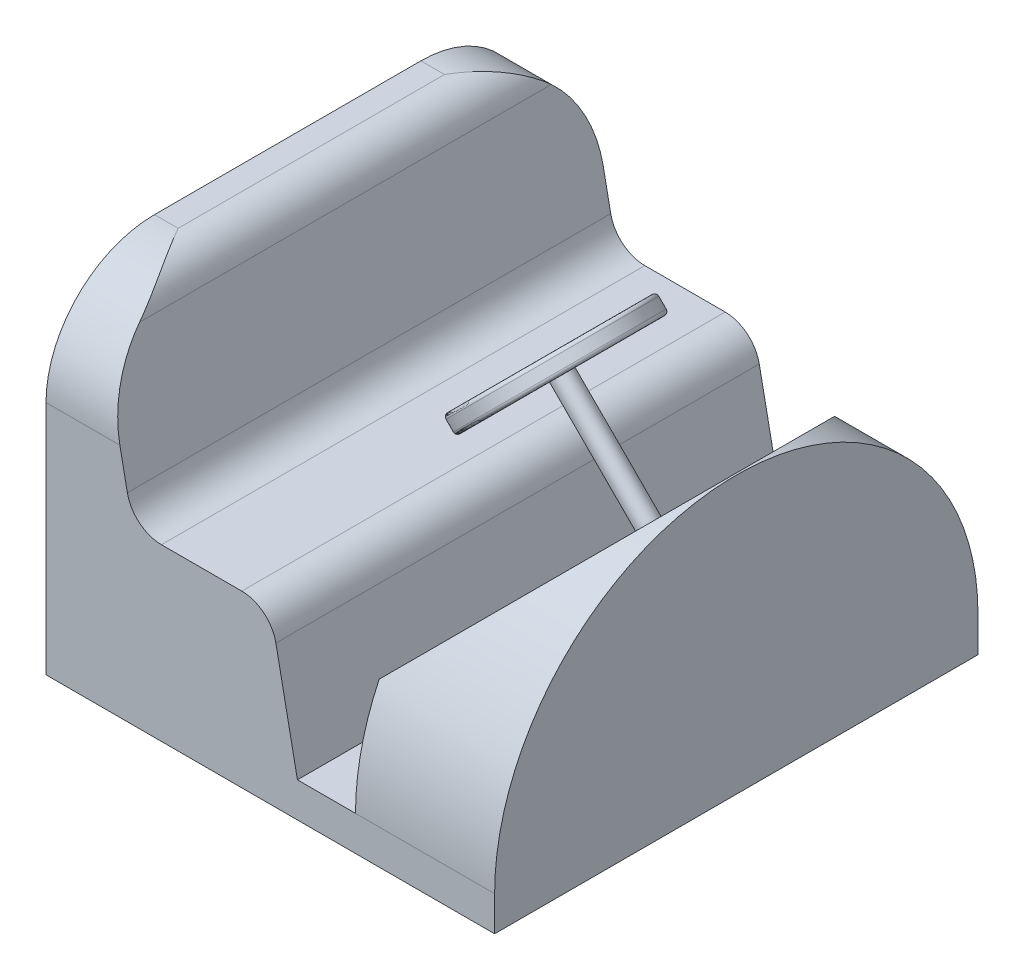
from build123d import *

# Parameters (mm, degrees)
BOSS_EXTRUDE1_DEPTH = 2.5399999999999996
BOSS_EXTRUDE2_DEPTH = 17.653
FILLET1_R           = 2.5399999999999996
FILLET2_R           = 7.9248
FILLET3_R           = 7.9248
BOSS_EXTRUDE3_DEPTH = 17.653
CUT_EXTRUDE2_REACH  = 46.917
SKETCH12_R          = 0.762
BOSS_EXTRUDE4_DEPTH = 10.16
SKETCH13_R          = 6.3500000000000005
BOSS_EXTRUDE5_DEPTH = 1.27
FILLET4_R           = 0.254


# Some blends are built 0.0001 mm under size
with BuildPart() as part:
    # Sketch2 → Boss-Extrude1 (new body)
    with BuildSketch(Plane(origin=(0, 0, 0), x_dir=(1, 0, 0), z_dir=(0, 1, 0))):
        Polygon((0, -17.653), (-32.766, -17.653000000000002), (-32.766000000000005, 17.652999999999988), (-6.49e-15, 17.653), align=None)
    extrude(amount=BOSS_EXTRUDE1_DEPTH)

    # Sketch3 → Boss-Extrude2 (add, symmetric)
    with BuildSketch(Plane.XY):
        Polygon((-32.766, 2.5399999999999996), (-32.766, 25.145999999999997), (-28.955999999999996, 25.145999999999997), (-26.415999999999997, 12.445999999999998), (-16.383, 12.446), (-14.401799999999998, 2.5399999999999996), align=None)
    extrude(amount=BOSS_EXTRUDE2_DEPTH, both=True)

    # Fillet1
    fillet1_edges = [part.edges().sort_by_distance(p)[0] for p in [
        (-16.383, 12.446, 0),
        (-26.415999999999997, 12.445999999999998, 0),
        (-28.955999999999996, 25.145999999999997, 0),
    ]]
    fillet(fillet1_edges, radius=FILLET1_R)

    # Fillet2
    # the kernel refuses this fillet: 7.9248 mm, written as the material it takes off along each edge
    with BuildSketch(Plane(origin=(-52.57799999999999, 25.145999999999997, 17.653000000000006), x_dir=(0, -1, 0), z_dir=(1, 0, 0))) as fillet2_piece_1:
        with BuildLine():
            CenterArc((FILLET2_R, FILLET2_R), FILLET2_R, 180, 90)
            Line((-3.55e-15, FILLET2_R), (0, 0))
            Line((0, 0), (FILLET2_R, 0))
        make_face()
    extrude(amount=41.35169808709485, mode=Mode.SUBTRACT)

    # Fillet3
    # the kernel refuses this fillet: 7.9248 mm, written as the material it takes off along each edge
    with BuildSketch(Plane(origin=(-52.57799999999999, 25.145999999999997, -17.65299999999998), x_dir=(0, -1, 0), z_dir=(1, 0, 0))) as fillet3_piece_1:
        with BuildLine():
            CenterArc((FILLET3_R, -FILLET3_R), FILLET3_R, 90, 90)
            Line((-3.55e-15, -FILLET3_R), (0, 0))
            Line((0, 0), (FILLET3_R, 0))
        make_face()
    extrude(amount=41.35169808709485, mode=Mode.SUBTRACT)

    # Sketch10 → Boss-Extrude3 (add, symmetric)
    with BuildSketch(Plane.XY):
        Polygon((0, 2.5399999999999996), (0, 20.32), (-10.160000000000004, 10.159999999999998), (-10.16, 2.539999999999999), align=None)
    extrude(amount=BOSS_EXTRUDE3_DEPTH, both=True)

    # Cut-Extrude2: up to this face of the body (flat: up to its plane)
    cut_extrude2_end = Plane(part.part.faces().sort_by_distance((-10.16, 6.35, 0))[0])
    # Sketch11 → Cut-Extrude2 (cut, up to the picked face)
    with BuildSketch(Plane(origin=(0, 0, 0), x_dir=(-1.8e-16, 0, -1), z_dir=(1, 0, -1.8e-16)), mode=Mode.PRIVATE) as cut_extrude2_sk1:
        with BuildLine():
            Line((-17.653, 2.5400000000000005), (-17.653, 20.32))
            Line((-17.653, 20.32), (17.653, 20.32))
            Line((17.653, 20.32), (17.653000000000006, 2.5400000000000005))
            ThreePointArc((17.653000000000006, 2.5400000000000005), (4.55e-15, 20.193), (-17.653, 2.5400000000000005))
        make_face()
    cut_extrude2_tool1 = split(extrude(cut_extrude2_sk1.sketch, amount=-CUT_EXTRUDE2_REACH, mode=Mode.PRIVATE), bisect_by=cut_extrude2_end, keep=Keep.BOTH, mode=Mode.PRIVATE)
    add(cut_extrude2_tool1.solids().sort_by(Axis((0, 11.43, 17.257697), (-1, 0, 1.8e-16)))[0], mode=Mode.SUBTRACT)

    # Sketch12 → Boss-Extrude4 (add)
    with BuildSketch(Plane(origin=(-10.160000000000005, 10.16000000000001, 0), x_dir=(0, 0, 1), z_dir=(-0.7071067811865475, 0.7071067811865478, 0))):
        with Locations(Location((-6.94e-15, 5.279846327358498, 0), (0, 0, 90))):
            Circle(SKETCH12_R)
    extrude(amount=BOSS_EXTRUDE4_DEPTH)


with BuildPart() as body_2:
    # Sketch13 → Boss-Extrude5 (new body)
    with BuildSketch(Plane(origin=(-17.344204896855334, 17.34420489685534, 0), x_dir=(0.7071067811865476, 0.7071067811865476, 0), z_dir=(-0.7071067811865476, 0.7071067811865476, 0))):
        with Locations(Location((5.279846327358498, 6.94e-15, 0), (0, 0, 180))):
            Circle(SKETCH13_R)
        with BuildLine():
            Line((4.8988463273584975, 5.702285857443493), (4.8988463273584975, 0.6599113576837506))
            ThreePointArc((4.898846327358498, 0.6599113576837483), (5.279846327358498, 0.7620000000000069), (5.660846327358498, 0.6599113576837505))
            Line((5.660846327358498, 0.6599113576837506), (5.660846327358498, 5.702285857443493))
            ThreePointArc((5.660846327358498, 5.702285857443493), (9.320961581839615, 4.041115254481125), (10.98213218480198, 0.3810000000000072))
            Line((10.982132184801982, 0.3810000000000072), (5.93975768504224, 0.3810000000000072))
            ThreePointArc((5.939757685042242, 0.3810000000000083), (6.0158818069907705, 0.1972201123681285), (6.041846327358501, 6.94e-15))
            ThreePointArc((6.041846327358501, 6.75e-15), (6.0158818069907705, -0.19722011236811451), (5.939757685042242, -0.380999999999994))
            Line((5.93975768504224, -0.38099999999999246), (10.982132184801982, -0.38099999999999246))
            ThreePointArc((10.982132184801983, -0.3809999999999925), (9.320961581839615, -4.041115254481111), (5.660846327358498, -5.70228585744348))
            Line((5.660846327358498, -5.702285857443479), (5.660846327358498, -0.6599113576837368))
            ThreePointArc((5.660846327358497, -0.659911357683737), (5.279846327358498, -0.7619999999999931), (4.898846327358498, -0.6599113576837341))
            Line((4.8988463273584975, -0.6599113576837368), (4.898846327358498, -5.702285857443479))
            ThreePointArc((4.898846327358498, -5.7022858574434805), (1.2387310728773802, -4.041115254481113), (-0.422439530084989, -0.3809999999999943))
            Line((-0.42243953008498814, -0.3809999999999942), (4.619934969674754, -0.38099999999999334))
            ThreePointArc((4.619934969674757, -0.3809999999999914), (4.5178463273585, 6.36e-15), (4.619934969674757, 0.38100000000000456))
            Line((4.619934969674754, 0.38100000000000633), (-0.42243953008498814, 0.38100000000000545))
            ThreePointArc((-0.42243953008498725, 0.3810000000000061), (1.2387310728773784, 4.0411152544811255), (4.8988463273584975, 5.702285857443493))
        make_face(mode=Mode.SUBTRACT)
    extrude(amount=-BOSS_EXTRUDE5_DEPTH)

    # Fillet4
    fillet4_edges = [body_2.edges().sort_by_distance(p)[0] for p in [
        (-10.46338774601902, 22.428970823477822, -0.3810000000000072),
        (-9.120661694622674, 25.567748099088, -5.38e-15),
        (-13.341382071525178, 21.347027722185498, -3.181098607563622),
        (-13.880197438789327, 20.80821235492135, -3.1810986075636216),
        (-16.468289755157254, 18.22012003855342, -4.041115254481127),
        (-15.860166152188569, 18.828243641522107, -0.3810000000000059),
        (-15.860166152188569, 18.828243641522107, 0.3809999999999938),
        (-10.46338774601902, 22.428970823477822, 0.38099999999999246),
        (-16.46828975515725, 18.220120038553425, 4.041115254481113),
        (-13.880197438789327, 20.80821235492135, 3.181098607563608),
        (-13.341382071525178, 21.347027722185498, 3.181098607563608),
        (-10.753289755157253, 23.93512003855342, 4.04111525448111),
        (-11.361413358125937, 23.32699643558474, 0.38099999999999246),
        (-11.361413358125937, 23.32699643558474, -0.3810000000000072),
        (-10.753289755157253, 23.93512003855342, -4.0411152544811255),
        (-9.855264143050336, 23.037094426446508, 4.04111525448111),
        (-12.443356459418261, 20.44900211007858, 3.181098607563608),
        (-12.98217182668241, 19.91018674281443, 3.181098607563608),
        (-15.570264143050336, 17.322094426446508, 4.041115254481113),
        (-14.962140540081652, 17.93021802941519, 0.3809999999999938),
        (-14.962140540081652, 17.93021802941519, -0.3810000000000059),
        (-15.570264143050336, 17.322094426446505, -4.041115254481127),
        (-12.98217182668241, 19.91018674281443, -3.1810986075636216),
        (-9.855264143050336, 23.037094426446508, -4.0411152544811255),
        (-12.443356459418261, 20.44900211007858, -3.181098607563622),
        (-8.222636082515757, 24.669722486981087, -5.38e-15),
    ]]
    fillet(fillet4_edges, radius=FILLET4_R - 0.0001)  # a hair under: the kernel refuses the full size


solid = Compound([part.part, body_2.part])
